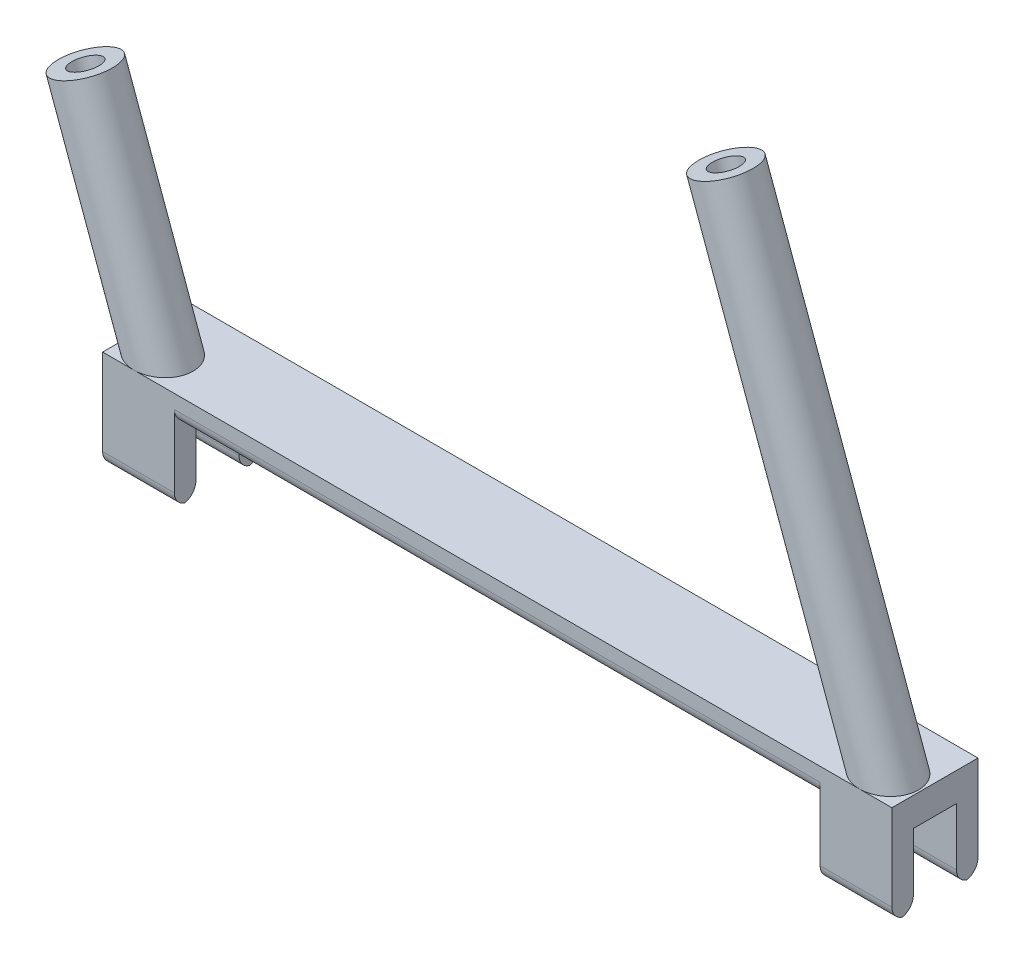
from build123d import *

# Parameters (mm, degrees)
ESQUISSE1_W                    = 110
ESQUISSE1_H                    = 14
BOSS_EXTRU_1_DEPTH             = 12
ESQUISSE2_W                    = 6
ESQUISSE2_H                    = 10
ENL_V_MAT_EXTRU_1_DEPTH        = 112.534747949
CONG_1_R                       = 2
ESQUISSE3_W                    = 90
ESQUISSE3_H                    = 10
ENL_V_MAT_EXTRU_2_DEPTH        = 12
CONG_2_R                       = 2
ESQUISSE6_R                    = 4
ESQUISSE6_R_2                  = 2
BOSS_EXTRU_2_DEPTH             = 30
BOSS_EXTRU_2_DIRECTION_2_REACH = 117.782


with BuildPart() as part:
    # Esquisse1 → Boss.-Extru.1 (new body)
    with BuildSketch(Plane.XY):
        with Locations((55, 7)):
            Rectangle(ESQUISSE1_W, ESQUISSE1_H)
    extrude(amount=BOSS_EXTRU_1_DEPTH)

    # Esquisse2 → Enlèv. mat.-Extru.1 (cut, through all)
    with BuildSketch(Plane.ZY):
        with Locations((6, 5)):
            Rectangle(ESQUISSE2_W, ESQUISSE2_H)
    extrude(amount=-ENL_V_MAT_EXTRU_1_DEPTH, mode=Mode.SUBTRACT)

    # Congé1
    # the kernel refuses this fillet: 2 mm, written as the material it takes off along each edge
    with BuildSketch(Plane(origin=(-5, 0, 12), x_dir=(0, 1, 0), z_dir=(1, 0, 0)), Plane(origin=(-5, 0, 9), x_dir=(0, 0, 1), z_dir=(1, 0, 0)), Plane(origin=(-5, 0, 0), x_dir=(0, 0, 1), z_dir=(1, 0, 0))) as cong_1_piece_1:
        with BuildLine():
            CenterArc((CONG_1_R, -CONG_1_R), CONG_1_R, 90, 90)
            Line((0, -CONG_1_R), (0, 0))
            Line((0, 0), (CONG_1_R, 0))
        make_face()
    extrude(amount=120, mode=Mode.SUBTRACT)
    with BuildSketch(Plane(origin=(-5, 0, 3), x_dir=(0, 0, -1), z_dir=(1, 0, 0))) as cong_1_piece_2:
        with BuildLine():
            CenterArc((CONG_1_R, CONG_1_R), CONG_1_R, 180, 90)
            Line((0, CONG_1_R), (0, 0))
            Line((0, 0), (CONG_1_R, 0))
        make_face()
    extrude(amount=120, mode=Mode.SUBTRACT)

    # Esquisse3 → Enlèv. mat.-Extru.2 (cut)
    with BuildSketch(Plane.XY.offset(12)):
        with Locations((55, 5.063508327)):
            Rectangle(ESQUISSE3_W, ESQUISSE3_H)
    extrude(amount=-ENL_V_MAT_EXTRU_2_DEPTH, mode=Mode.SUBTRACT)

    # Congé2
    cong_2_edges = [part.edges().sort_by_distance(p)[0] for p in [
        (55, 10.063508327, 12),
        (55, 10.063508327, 0),
    ]]
    fillet(cong_2_edges, radius=CONG_2_R)

    # Esquisse6 → Boss.-Extru.2 (add)
    # profile 1 of 2: a face of its own
    with BuildSketch(Plane(origin=(-4.499513268, 12.362311102, 0), x_dir=(0, 0, -1), z_dir=(-0.34202014332565694, 0.9396926207859128, 0))):
        with Locations(Location((-8, -8.888282007, 0), (0, 0, 90))):
            Circle(ESQUISSE6_R)
        with Locations(Location((-8, -8.888282007, 0), (0, 0, 90))):
            Circle(ESQUISSE6_R_2, mode=Mode.SUBTRACT)
    # profile 2 of 2: a face of its own
    with BuildSketch(Plane(origin=(-4.499513268, 12.362311102, 0), x_dir=(0, 0, -1), z_dir=(-0.34202014332565694, 0.9396926207859128, 0))):
        with Locations(Location((-8, -103.888282007, 0), (0, 0, 90))):
            Circle(ESQUISSE6_R)
        with Locations(Location((-8, -103.888282007, 0), (0, 0, 90))):
            Circle(ESQUISSE6_R_2, mode=Mode.SUBTRACT)
    extrude(amount=BOSS_EXTRU_2_DEPTH)

    # Esquisse6 → Boss.-Extru.2 direction 2 (add, up to next)
    with BuildSketch(Plane(origin=(-4.499513268, 12.362311102, 0), x_dir=(0, 0, -1), z_dir=(-0.34202014332565694, 0.9396926207859128, 0)), mode=Mode.PRIVATE) as boss_extru_2_direction_2_sk1:
        with Locations(Location((-8, -8.888282007, 0), (0, 0, 90))):
            Circle(ESQUISSE6_R)
        with Locations(Location((-8, -8.888282007, 0), (0, 0, 90))):
            Circle(ESQUISSE6_R_2, mode=Mode.SUBTRACT)
    boss_extru_2_direction_2_tool1 = extrude(boss_extru_2_direction_2_sk1.sketch, amount=-BOSS_EXTRU_2_DIRECTION_2_REACH, mode=Mode.PRIVATE) - part.part
    # Esquisse6 → Boss.-Extru.2 direction 2 (add, up to next)
    with BuildSketch(Plane(origin=(-4.499513268, 12.362311102, 0), x_dir=(0, 0, -1), z_dir=(-0.34202014332565694, 0.9396926207859128, 0)), mode=Mode.PRIVATE) as boss_extru_2_direction_2_sk2:
        with Locations(Location((-8, -103.888282007, 0), (0, 0, 90))):
            Circle(ESQUISSE6_R)
        with Locations(Location((-8, -103.888282007, 0), (0, 0, 90))):
            Circle(ESQUISSE6_R_2, mode=Mode.SUBTRACT)
    boss_extru_2_direction_2_tool2 = extrude(boss_extru_2_direction_2_sk2.sketch, amount=-BOSS_EXTRU_2_DIRECTION_2_REACH, mode=Mode.PRIVATE) - part.part
    add(boss_extru_2_direction_2_tool1.solids().sort_by_distance((7.505196, 16.731668, 8))[0])
    add(boss_extru_2_direction_2_tool2.solids().sort_by_distance((96.775995, 49.223582, 8))[0])


solid = part.part
